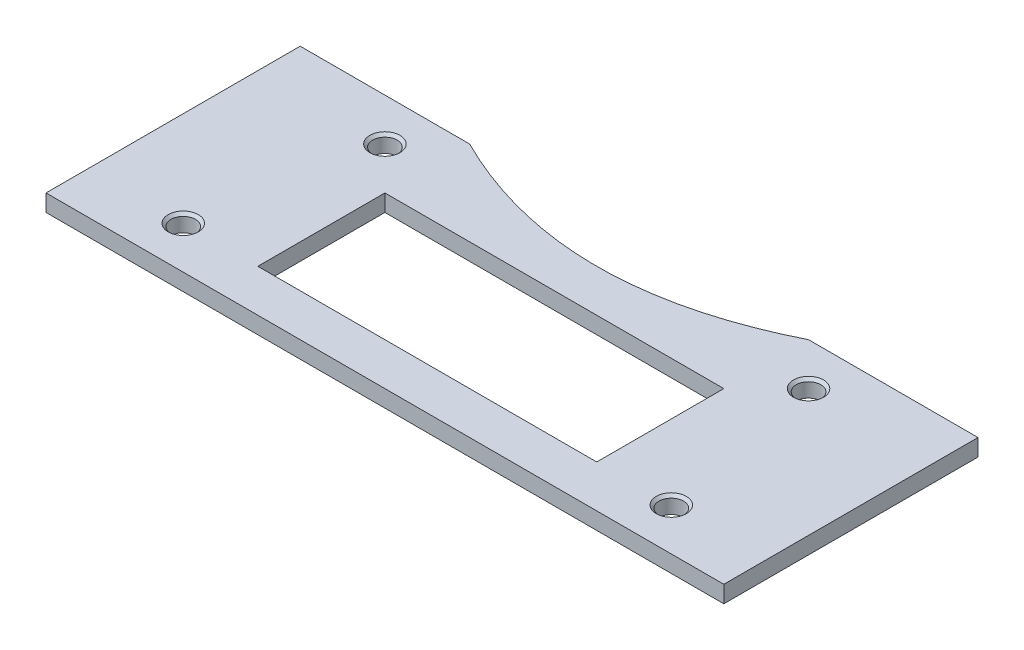
from build123d import *

# Parameters (mm, degrees)
SKETCH_1_W                     = 80
SKETCH_1_H                     = 30
EXTRUDE_1_DEPTH                = 2
HOLE_WIZARD_M3_5_1_D           = 2.9
HOLE_WIZARD_M3_5_1_CSINK_D     = 3.55
HOLE_WIZARD_M3_5_1_CSINK_ANGLE = 90
SKETCH_2_R                     = 1
SKETCH_2_W                     = 40
SKETCH_2_H                     = 15
CUT_EXTRUDE_2_DEPTH            = 10
CUT_EXTRUDE_5_DEPTH            = 10


with BuildPart() as part:
    # 草图1 → 凸台-拉伸1 (new body)
    with BuildSketch(Plane(origin=(0, 0, 0), x_dir=(1, 0, 0), z_dir=(0, 1, 0))):
        with Locations((40, 15)):
            Rectangle(SKETCH_1_W, SKETCH_1_H)
    extrude(amount=EXTRUDE_1_DEPTH)

    # M3.5 螺纹孔1 (through all)
    with Locations(Plane(origin=(0, 2, 0), x_dir=(1, 0, 0), z_dir=(0, 1, 0))):
        with Locations((15, 25), (11.2, 5), (65, 25), (68.8, 5)):
            CounterSinkHole(HOLE_WIZARD_M3_5_1_D / 2, HOLE_WIZARD_M3_5_1_CSINK_D / 2, counter_sink_angle=HOLE_WIZARD_M3_5_1_CSINK_ANGLE)

    # 草图2 → 切除-拉伸2 (cut)
    with BuildSketch(Plane(origin=(0, 2, 0), x_dir=(1, 0, 0), z_dir=(0, 1, 0))):
        with Locations((15, 25)):
            Circle(SKETCH_2_R)
        with Locations((65, 25)):
            Circle(SKETCH_2_R)
        with Locations((11.2, 5)):
            Circle(SKETCH_2_R)
        with Locations((68.8, 5)):
            Circle(SKETCH_2_R)
        with Locations((40, 12.5)):
            Rectangle(SKETCH_2_W, SKETCH_2_H)
    extrude(amount=-CUT_EXTRUDE_2_DEPTH, mode=Mode.SUBTRACT)

    # 草图7 → 切除-拉伸5 (cut)
    with BuildSketch(Plane(origin=(0, 2, 0), x_dir=(1, 0, 0), z_dir=(0, 1, 0))):
        with BuildLine():
            Line((60, 30), (20, 30))
            add(Edge.make_bspline(
                [(20, 30), (40, 20), (60, 30)],
                knots=[0, 0, 0, 1, 1, 1], degree=2))
        make_face()
    extrude(amount=-CUT_EXTRUDE_5_DEPTH, mode=Mode.SUBTRACT)


solid = part.part
